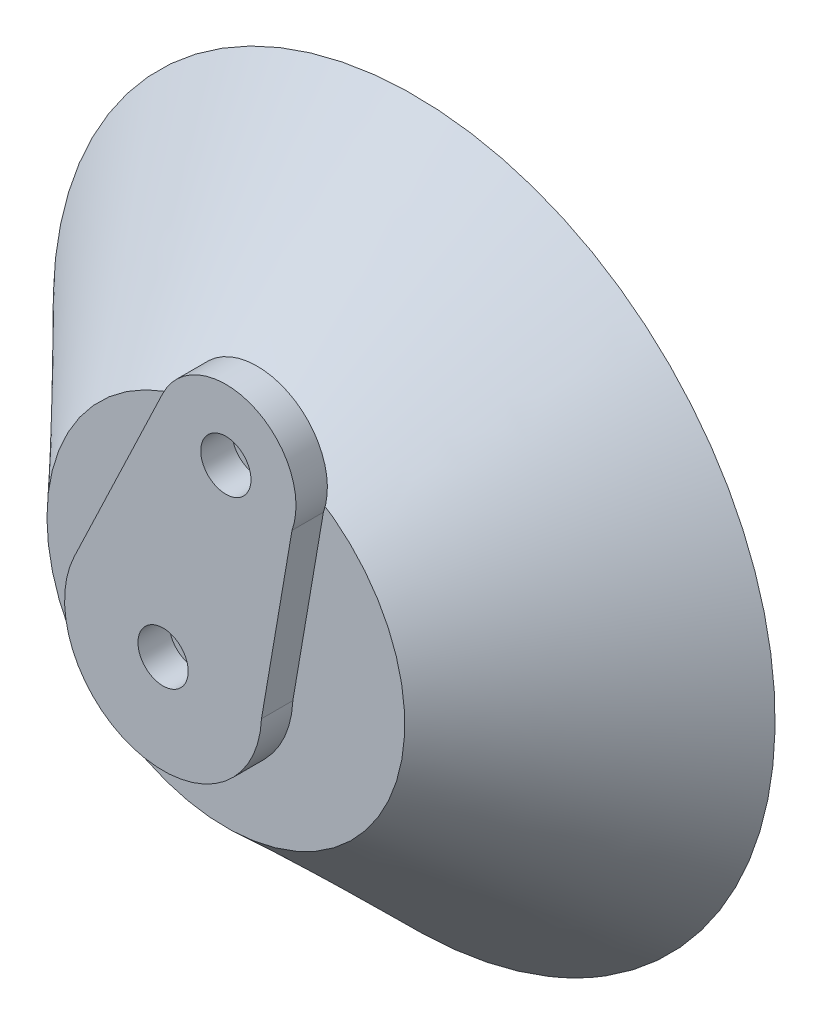
from build123d import *

# Parameters (mm, degrees)
SKETCH3_R           = 10
CUT_EXTRUDE1_DEPTH  = 87.674679284
SKETCH5_R           = 4
BOSS_EXTRUDE1_DEPTH = 5


with BuildPart() as part:
    # Loft1: read off the stored shape, not the designer's step
    # Loft1: loft between two sections, ruled curve by curve
    loft1_from = [
        Edge.make_bspline([(-11.518722123, 56.334439206, 0), (-124.187600535, 33.29699496, 0), (-101.150156289, -79.371883452, 0), (11.518722123, -56.334439206, 0), (124.187600535, -33.29699496, 0), (101.150156289, 79.371883452, 0), (-11.518722123, 56.334439206, 0)], [0, 0, 0, 0, 0.5, 0.5, 0.5, 1, 1, 1, 1], 3, [1, 0.333333333, 0.333333333, 1, 0.333333333, 0.333333333, 1]),
    ]
    loft1_to = [
        Edge.make_bspline([(0.805711153, 28.488608768, 30), (-56.171506383, 30.100031074, 30), (-57.782928689, -26.877186462, 30), (-0.805711153, -28.488608768, 30), (56.171506383, -30.100031074, 30), (57.782928689, 26.877186462, 30), (0.805711153, 28.488608768, 30)], [0, 0, 0, 0, 0.5, 0.5, 0.5, 1, 1, 1, 1], 3, [1, 0.333333333, 0.333333333, 1, 0.333333333, 0.333333333, 1]),
    ]
    loft1 = Solid(Shell([*[Face.make_surface_from_curves(loft1_from[k], loft1_to[k]) for k in range(1)], Face(Wire(loft1_from)), Face(Wire(loft1_to))]))
    add(loft1)

    # Sketch3 → Cut-Extrude1 (cut, through all)
    with BuildSketch(Plane.XY.offset(30)):
        Circle(SKETCH3_R)
    extrude(amount=-CUT_EXTRUDE1_DEPTH, mode=Mode.SUBTRACT)


with BuildPart() as body_2:
    # Sketch5 → Boss-Extrude1 (new body)
    with BuildSketch(Plane.XY.offset(35)):
        with BuildLine():
            Line((20.53658968, 27.734193457), (15.674084092, -0.686210928))
            ThreePointArc((15.674084092, -0.686210928), (-3.79737719, -15.222605691), (-14.159917768, 6.756073293))
            Line((-14.159917768, 6.756073293), (-0.083141296, 36.25930522))
            ThreePointArc((-0.083141296, 36.25930522), (14.268581322, 41.772809638), (20.53658968, 27.734193457))
        make_face()
        with Locations((10, 31.448370387)):
            Circle(SKETCH5_R, mode=Mode.SUBTRACT)
        Circle(SKETCH5_R, mode=Mode.SUBTRACT)
    extrude(amount=BOSS_EXTRUDE1_DEPTH)


solid = Compound([part.part, body_2.part])
